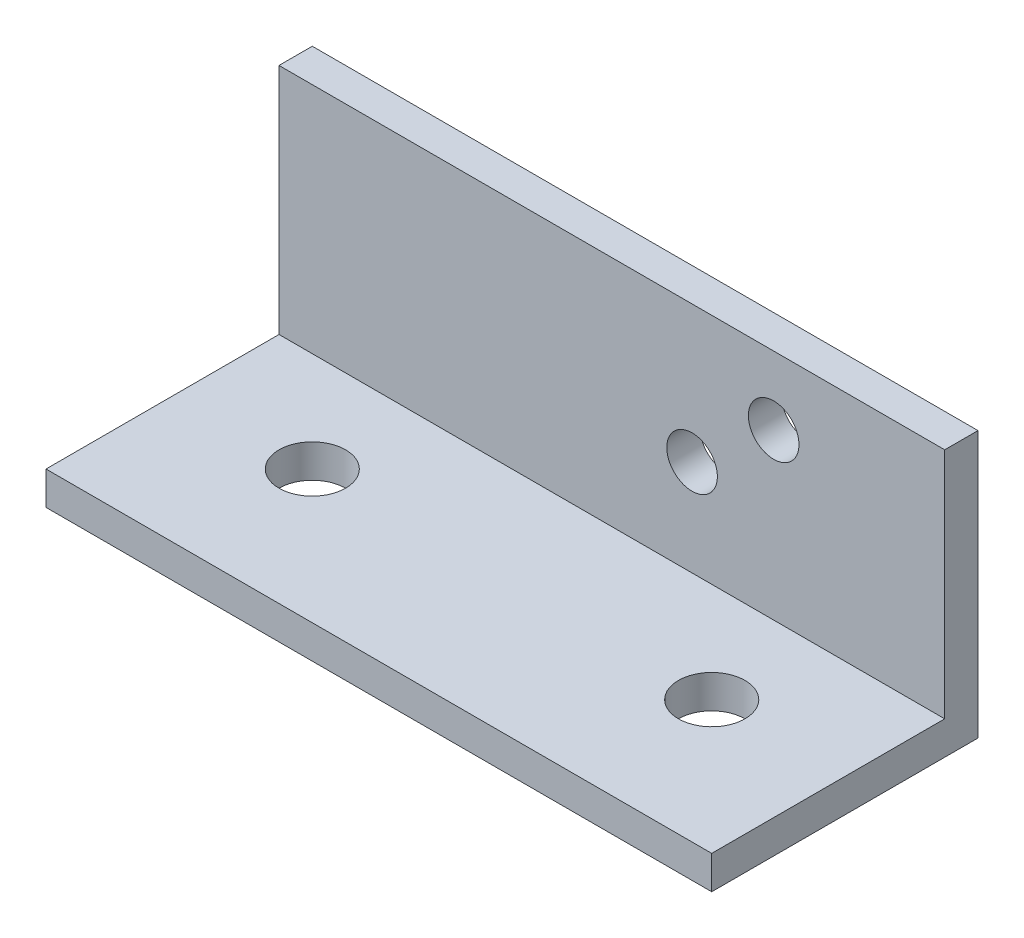
from build123d import *

# Parameters (mm, degrees)
SKETCH1_W           = 63.5
SKETCH1_H           = 25.4
BOSS_EXTRUDE1_DEPTH = 3.175
SKETCH2_W           = 63.5
SKETCH2_H           = 3.175
BOSS_EXTRUDE2_DEPTH = 22.225
SKETCH3_R           = 3.175
CUT_EXTRUDE1_DEPTH  = 3.175
SKETCH4_R           = 2.413
CUT_EXTRUDE2_DEPTH  = 3.175


with BuildPart() as part:
    # Sketch1 → Boss-Extrude1 (new body)
    with BuildSketch(Plane(origin=(0, 0, 0), x_dir=(1, 0, 0), z_dir=(0, 1, 0))):
        with Locations((31.75, -12.7)):
            Rectangle(SKETCH1_W, SKETCH1_H)
    extrude(amount=BOSS_EXTRUDE1_DEPTH)

    # Sketch2 → Boss-Extrude2 (add)
    with BuildSketch(Plane(origin=(0, 3.175, 0), x_dir=(1, 0, 0), z_dir=(0, 1, 0))):
        with Locations((31.75, -1.5875)):
            Rectangle(SKETCH2_W, SKETCH2_H)
    extrude(amount=BOSS_EXTRUDE2_DEPTH)

    # Sketch3 → Cut-Extrude1 (cut)
    with BuildSketch(Plane(origin=(0, 3.175, 0), x_dir=(1, 0, 0), z_dir=(0, 1, 0))):
        with Locations((12.7, -12.7)):
            Circle(SKETCH3_R)
        with Locations((50.8, -12.7)):
            Circle(SKETCH3_R)
    extrude(amount=-CUT_EXTRUDE1_DEPTH, mode=Mode.SUBTRACT)

    # Sketch4 → Cut-Extrude2 (cut)
    with BuildSketch(Plane(origin=(0, 0, 0), x_dir=(-1, 0, 0), z_dir=(0, 0, -1))):
        with Locations((-47.184645461, 18.869277886)):
            Circle(SKETCH4_R)
        with Locations((-39.401633919, 12.338555771)):
            Circle(SKETCH4_R)
    extrude(amount=-CUT_EXTRUDE2_DEPTH, mode=Mode.SUBTRACT)


solid = part.part
